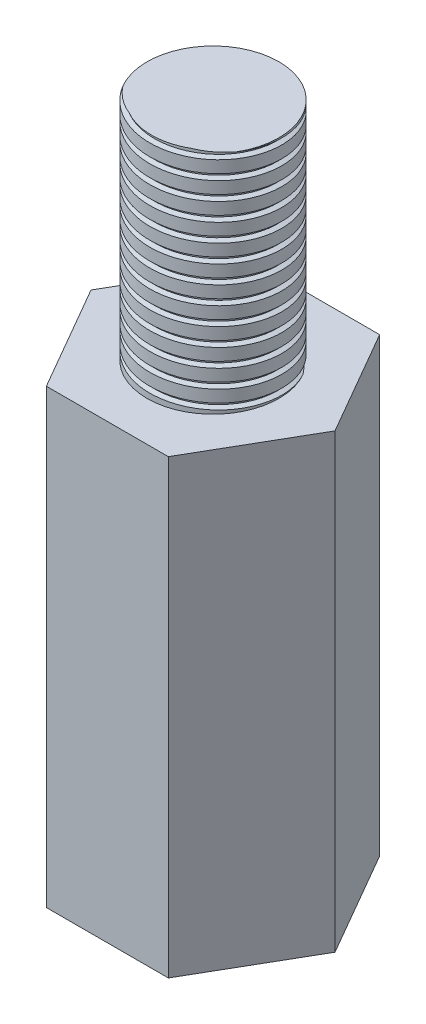
from build123d import *

# Parameters (mm, degrees)
SKETCH_1_R          = 1.46
EXTRUDE_1_DEPTH     = 10
SKETCH_1_3_R        = 1.46
CUT_EXTRUDE_1_DEPTH = 5
SKETCH_2_R          = 1.46
EXTRUDE_2_DEPTH     = 5
SWEEP_1_PITCH       = 0.4
SWEEP_1_FROM        = -0.1
SWEEP_2_PITCH       = 0.4


with BuildPart() as part:
    # 草图1 → 凸台-拉伸1 (new body)
    # profile 1 of 2: a face of its own
    with BuildSketch(Plane(origin=(0, 0, 0), x_dir=(1, 0, 0), z_dir=(0, 1, 0))):
        Polygon((-2.70199926, 0), (-1.35099963, -2.34), (1.35099963, -2.34), (2.70199926, 0), (1.35099963, 2.34), (-1.35099963, 2.34), align=None)
        Circle(SKETCH_1_R, mode=Mode.SUBTRACT)
    # profile 2 of 2: a face of its own
    with BuildSketch(Plane(origin=(0, 0, 0), x_dir=(1, 0, 0), z_dir=(0, 1, 0))):
        Circle(SKETCH_1_R)
    extrude(amount=EXTRUDE_1_DEPTH)

    # 草图1<3> → 切除-拉伸1 (cut)
    with BuildSketch(Plane(origin=(0, 0, 0), x_dir=(1, 0, 0), z_dir=(0, 1, 0))):
        with Locations(Location((0, 0, 0), (0, 0, 270))):
            Circle(SKETCH_1_3_R)
    extrude(amount=CUT_EXTRUDE_1_DEPTH, mode=Mode.SUBTRACT)

    # 切除-扫描2: arcs per turn and ends read off the stored shape
    # 切除-扫描2: the profile of 草图7 profile screwed along a right-hand helix through 23.75 turns, 6 arcs to a turn; built about Z, then put on its axis
    sweep_2_z = Axis((0, 0, 0), (0, 0, 1))
    sweep_2_corners = [(1.4597, 0, 0.1001), (1.66, 0, 0.033333333), (1.66, 0, -0.033333333), (1.4597, 0, -0.1001)]
    with BuildLine(mode=Mode.PRIVATE) as sweep_2_profile:
        Line(sweep_2_corners[0], sweep_2_corners[1])
        Line(sweep_2_corners[1], sweep_2_corners[2])
        Line(sweep_2_corners[2], sweep_2_corners[3])
        Line(sweep_2_corners[3], sweep_2_corners[0])
    sweep_2_cap = Face(sweep_2_profile.wire())
    sweep_2_turn_angles = [0, 30, 60, 90, 120, 150, 180, 210, 240, 270, 300, 330, 360]
    sweep_2_turn_weights = [1, 0.8660254037844387, 1, 0.8660254037844387, 1, 0.8660254037844387, 1, 0.8660254037844387, 1, 0.8660254037844387, 1, 0.8660254037844387, 1]
    sweep_2_turn_rails = [Edge.make_bspline([Vector(p[0], p[1], 0).rotate(sweep_2_z, sweep_2_turn_angles[k]) / sweep_2_turn_weights[k] + Vector(0, 0, p[2] + SWEEP_2_PITCH * sweep_2_turn_angles[k] / 360) for k in range(13)], [0, 0, 0, 1, 1, 2, 2, 3, 3, 4, 4, 5, 5, 6, 6, 6], 2, sweep_2_turn_weights) for p in sweep_2_corners]
    sweep_2_turn_sides = [Face.make_surface_from_curves(sweep_2_turn_rails[p[0]], sweep_2_turn_rails[p[1]]) for p in [(0, 1), (1, 2), (2, 3), (3, 0)]]
    sweep_2_last_angles = [8280, 8310, 8340, 8370, 8400, 8430, 8460, 8490, 8520, 8535, 8550]
    sweep_2_last_weights = [1, 0.8660254037844387, 1, 0.8660254037844387, 1, 0.8660254037844387, 1, 0.8660254037844387, 1, 0.965925826289056, 1]
    sweep_2_last_rails = [Edge.make_bspline([Vector(p[0], p[1], 0).rotate(sweep_2_z, sweep_2_last_angles[k]) / sweep_2_last_weights[k] + Vector(0, 0, p[2] + SWEEP_2_PITCH * sweep_2_last_angles[k] / 360) for k in range(11)], [0, 0, 0, 1, 1, 2, 2, 3, 3, 4, 4, 5, 5, 5], 2, sweep_2_last_weights) for p in sweep_2_corners]
    sweep_2_last_sides = [Face.make_surface_from_curves(sweep_2_last_rails[p[0]], sweep_2_last_rails[p[1]]) for p in [(0, 1), (1, 2), (2, 3), (3, 0)]]
    sweep_2 = Plane(origin=(0, 0, 0), x_dir=(0, 0, -1), z_dir=(0, 1, 0)) * Solid(Shell([*[p.moved(Location((0, 0, SWEEP_2_PITCH * i))) for i in range(23) for p in sweep_2_turn_sides], *sweep_2_last_sides, sweep_2_cap, sweep_2_cap.rotate(sweep_2_z, 8550).moved(Location((0, 0, SWEEP_2_PITCH * 8550 / 360)))]))
    add(sweep_2, mode=Mode.SUBTRACT)


with BuildPart() as body_2:
    # 草图2 → 凸台-拉伸2 (new body)
    with BuildSketch(Plane(origin=(0, 10, 0), x_dir=(1, 0, 0), z_dir=(0, 1, 0))):
        with Locations(Location((0, 0, 0), (0, 0, 270))):
            Circle(SKETCH_2_R)
    extrude(amount=EXTRUDE_2_DEPTH)

    # 切除-扫描1: arcs per turn and ends read off the stored shape
    # 切除-扫描1: the profile of 草图4 screwed along a left-hand helix through 18.75 turns, 6 arcs to a turn; built about Z, then put on its axis
    sweep_1_z = Axis((0, 0, 0), (0, 0, 1))
    sweep_1_corners = [(1.56, 5.45e-07, -0.400000022), (1.56, 5.45e-07, -0.200000022), (1.36, 4.75e-07, -0.266666689), (1.36, 4.75e-07, -0.333333356)]
    with BuildLine(mode=Mode.PRIVATE) as sweep_1_profile:
        Line(sweep_1_corners[0], sweep_1_corners[1])
        Line(sweep_1_corners[1], sweep_1_corners[2])
        Line(sweep_1_corners[2], sweep_1_corners[3])
        Line(sweep_1_corners[3], sweep_1_corners[0])
    sweep_1_cap = Face(sweep_1_profile.wire())
    sweep_1_turn_angles = [0, -30, -60, -90, -120, -150, -180, -210, -240, -270, -300, -330, -360]
    sweep_1_turn_weights = [1, 0.8660254037844387, 1, 0.8660254037844387, 1, 0.8660254037844387, 1, 0.8660254037844387, 1, 0.8660254037844387, 1, 0.8660254037844387, 1]
    sweep_1_turn_rails = [Edge.make_bspline([Vector(p[0], p[1], 0).rotate(sweep_1_z, sweep_1_turn_angles[k]) / sweep_1_turn_weights[k] + Vector(0, 0, p[2] + -SWEEP_1_PITCH * sweep_1_turn_angles[k] / 360) for k in range(13)], [0, 0, 0, 1, 1, 2, 2, 3, 3, 4, 4, 5, 5, 6, 6, 6], 2, sweep_1_turn_weights) for p in sweep_1_corners]
    sweep_1_turn_sides = [Face.make_surface_from_curves(sweep_1_turn_rails[p[0]], sweep_1_turn_rails[p[1]]) for p in [(0, 1), (1, 2), (2, 3), (3, 0)]]
    sweep_1_last_angles = [-6480, -6510, -6540, -6570, -6600, -6630, -6660, -6690, -6720, -6735, -6750]
    sweep_1_last_weights = [1, 0.8660254037844387, 1, 0.8660254037844387, 1, 0.8660254037844387, 1, 0.8660254037844387, 1, 0.965925826288943, 1]
    sweep_1_last_rails = [Edge.make_bspline([Vector(p[0], p[1], 0).rotate(sweep_1_z, sweep_1_last_angles[k]) / sweep_1_last_weights[k] + Vector(0, 0, p[2] + -SWEEP_1_PITCH * sweep_1_last_angles[k] / 360) for k in range(11)], [0, 0, 0, 1, 1, 2, 2, 3, 3, 4, 4, 5, 5, 5], 2, sweep_1_last_weights) for p in sweep_1_corners]
    sweep_1_last_sides = [Face.make_surface_from_curves(sweep_1_last_rails[p[0]], sweep_1_last_rails[p[1]]) for p in [(0, 1), (1, 2), (2, 3), (3, 0)]]
    sweep_1 = Plane(origin=(0, 10.1, 0), x_dir=(0, 0, 1), z_dir=(0, 1, 0)) * split(Solid(Shell([*[p.moved(Location((0, 0, SWEEP_1_PITCH * i))) for i in range(18) for p in sweep_1_turn_sides], *sweep_1_last_sides, sweep_1_cap, sweep_1_cap.rotate(sweep_1_z, -6750).moved(Location((0, 0, -SWEEP_1_PITCH * -6750 / 360)))])), bisect_by=Plane.XY.offset(SWEEP_1_FROM), keep=Keep.TOP, mode=Mode.PRIVATE)
    add(sweep_1, mode=Mode.SUBTRACT)


solid = Compound([part.part, body_2.part])
